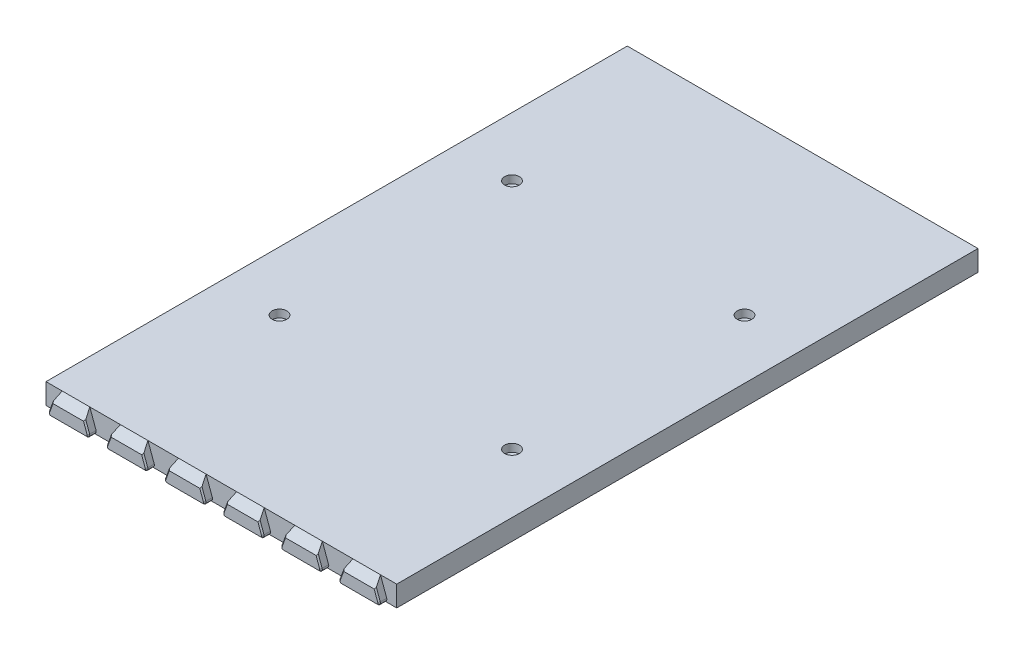
from build123d import *

# Parameters (mm, degrees)
BOSS_EXTRUDE1_DEPTH             = 112.5
SKETCH7_W                       = 131.75
SKETCH7_H                       = 6
BOSS_EXTRUDE7_DEPTH             = 1
BOSS_EXTRUDE4_DEPTH             = 3
BOSS_EXTRUDE8_REACH             = 133.633
BOSS_EXTRUDE8_DIRECTION_2_DEPTH = 2
CHAMFER4_SIZE                   = 0.5
FILLET4_R                       = 1
CHAMFER6_SIZE                   = 0.5
FILLET2_R                       = 2
CHAMFER4_OF_MIRROR2_SIZE        = 0.5
FILLET4_OF_MIRROR2_R            = 1
CHAMFER6_OF_MIRROR2_SIZE        = 0.5
FILLET2_OF_MIRROR2_R            = 2
BOSS_EXTRUDE9_REACH             = 240.023
SKETCH9_R                       = 5
FILLET3_R                       = 3
SKETCH10_R                      = 1.85
CUT_EXTRUDE2_DEPTH              = 239.023140944
SKETCH11_R                      = 2.85
CUT_EXTRUDE3_DEPTH              = 3
CHAMFER7_SIZE                   = 1
CUT_EXTRUDE4_DEPTH              = 239.023140944
CUT_EXTRUDE4_DEPTH_BACK         = 239.023140944


with BuildPart() as part:
    # Sketch1 → Boss-Extrude1 (new body)
    with BuildSketch(Plane.XY):
        Polygon((-67.875, 0), (-67.875, 8), (67.875, 8), (67.875, 0), (65.875, 0), (65.875, 6), (-65.875, 6), (-65.875, 0), align=None)
    boss_extrude1 = extrude(amount=-BOSS_EXTRUDE1_DEPTH)

    # Sketch7 → Boss-Extrude7 (add)
    with BuildSketch(Plane.XY):
        with Locations((0, 3)):
            Rectangle(SKETCH7_W, SKETCH7_H)
    boss_extrude7 = extrude(amount=-BOSS_EXTRUDE7_DEPTH)

    # Sketch2 → Boss-Extrude4 (add)
    with BuildSketch(Plane.XY):
        Polygon((50.911761874, 8), (48, 0), (64.5, 0), (61.588238126, 8), align=None)
        Polygon((28.411761874, 8), (25.5, 0), (42, 0), (39.088238126, 8), align=None)
        Polygon((5.911761874, 8), (3, 0), (19.5, 0), (16.588238126, 8), align=None)
        Polygon((-16.588238126, 8), (-19.5, 0), (-3, 0), (-5.911761874, 8), align=None)
        Polygon((-39.088238126, 8), (-42, 0), (-25.5, 0), (-28.411761874, 8), align=None)
        Polygon((-61.588238126, 8), (-64.5, 0), (-48, 0), (-50.911761874, 8), align=None)
    boss_extrude4 = extrude(amount=BOSS_EXTRUDE4_DEPTH)

    # Sketch8 → Boss-Extrude8 (add, up to next)
    with BuildSketch(Plane.XZ, mode=Mode.PRIVATE) as boss_extrude8_sk1:
        Polygon((-66.35, -20.258341264), (-62.65, -21.605031131), (-62.65, -23.394968869), (-66.35, -24.741658736), align=None)
    boss_extrude8_tool1 = extrude(boss_extrude8_sk1.sketch, amount=-BOSS_EXTRUDE8_REACH, mode=Mode.PRIVATE) - part.part
    # Sketch8 → Boss-Extrude8 (add, up to next)
    with BuildSketch(Plane.XZ, mode=Mode.PRIVATE) as boss_extrude8_sk2:
        Polygon((-66.35, -110.258341264), (-62.65, -111.605031131), (-62.65, -112.35), (-62.65, -112.5), (-66.35, -112.5), (-66.35, -112.35), align=None)
    boss_extrude8_tool2 = extrude(boss_extrude8_sk2.sketch, amount=-BOSS_EXTRUDE8_REACH, mode=Mode.PRIVATE) - part.part
    # Sketch8 → Boss-Extrude8 (add, up to next)
    with BuildSketch(Plane.XZ, mode=Mode.PRIVATE) as boss_extrude8_sk3:
        Polygon((66.35, -24.741658736), (66.35, -20.258341264), (62.65, -21.605031131), (62.65, -23.394968869), align=None)
    boss_extrude8_tool3 = extrude(boss_extrude8_sk3.sketch, amount=-BOSS_EXTRUDE8_REACH, mode=Mode.PRIVATE) - part.part
    # Sketch8 → Boss-Extrude8 (add, up to next)
    with BuildSketch(Plane.XZ, mode=Mode.PRIVATE) as boss_extrude8_sk4:
        Polygon((66.35, -112.5), (62.65, -112.5), (62.65, -112.35), (62.65, -111.605031131), (66.35, -110.258341264), (66.35, -112.35), align=None)
    boss_extrude8_tool4 = extrude(boss_extrude8_sk4.sketch, amount=-BOSS_EXTRUDE8_REACH, mode=Mode.PRIVATE) - part.part
    boss_extrude8_1 = boss_extrude8_tool1.solids().sort_by_distance((-64.764762, 0, -22.5))[0]
    add(boss_extrude8_1)
    boss_extrude8_2 = boss_extrude8_tool2.solids().sort_by_distance((-64.764762, 0, -111.66766))[0]
    add(boss_extrude8_2)
    boss_extrude8_3 = boss_extrude8_tool3.solids().sort_by_distance((64.764762, 0, -22.5))[0]
    add(boss_extrude8_3)
    boss_extrude8_4 = boss_extrude8_tool4.solids().sort_by_distance((64.764762, 0, -111.66766))[0]
    add(boss_extrude8_4)
    boss_extrude8 = boss_extrude8_1 + boss_extrude8_2 + boss_extrude8_3 + boss_extrude8_4  # Boss-Extrude8 as one shape, for the pattern or mirror that repeats it

    # Sketch8 → Boss-Extrude8 direction 2 (add)
    with BuildSketch(Plane.XZ):
        Polygon((-66.35, -20.258341264), (-62.65, -21.605031131), (-62.65, -23.394968869), (-66.35, -24.741658736), align=None)
        Polygon((-66.35, -110.258341264), (-62.65, -111.605031131), (-62.65, -112.35), (-62.65, -112.5), (-66.35, -112.5), (-66.35, -112.35), align=None)
        Polygon((66.35, -24.741658736), (66.35, -20.258341264), (62.65, -21.605031131), (62.65, -23.394968869), align=None)
        Polygon((66.35, -112.5), (62.65, -112.5), (62.65, -112.35), (62.65, -111.605031131), (66.35, -110.258341264), (66.35, -112.35), align=None)
    boss_extrude8_direction_2 = extrude(amount=BOSS_EXTRUDE8_DIRECTION_2_DEPTH)

    # Chamfer4
    chamfer4_edges = [part.edges().sort_by_distance(p)[0] for p in [
        (-66.35, -2, -22.5),
        (-64.5, -2, -24.068313803),
        (-62.65, -2, -22.5),
        (-64.5, -2, -20.931686197),
        (-66.35, -2, -111.379170632),
        (-62.65, -2, -112.052515565),
        (-64.5, -2, -110.931686197),
        (66.35, -2, -111.379170632),
        (64.5, -2, -110.931686197),
        (62.65, -2, -112.052515565),
        (64.5, -2, -24.068313803),
        (66.35, -2, -22.5),
        (64.5, -2, -20.931686197),
        (62.65, -2, -22.5),
    ]]
    chamfer(chamfer4_edges, length=CHAMFER4_SIZE)

    # Fillet4
    fillet4_edges = [part.edges().sort_by_distance(p)[0] for p in [
        (-64.5, 0, 1.5),
        (-48, 0, 1.5),
        (48, 0, 1.5),
        (64.5, 0, 1.5),
        (25.5, 0, 1.5),
        (42, 0, 1.5),
        (3, 0, 1.5),
        (19.5, 0, 1.5),
        (-42, 0, 1.5),
        (-25.5, 0, 1.5),
        (-19.5, 0, 1.5),
        (-3, 0, 1.5),
    ]]
    fillet(fillet4_edges, radius=FILLET4_R)

    # Chamfer6
    chamfer6_edges = [part.edges().sort_by_distance(p)[0] for p in [
        (-62.79989137, 4.671010072, 3),
        (62.79989137, 4.671010072, 3),
        (56.25, 0, 3),
        (33.75, 0, 3),
        (11.25, 0, 3),
        (-11.25, 0, 3),
        (-33.75, 0, 3),
        (-56.25, 0, 3),
        (48.608995962, 0.426423564, 3),
        (63.891004038, 0.426423564, 3),
        (40.29989137, 4.671010072, 3),
        (26.108995962, 0.426423564, 3),
        (41.391004038, 0.426423564, 3),
        (17.79989137, 4.671010072, 3),
        (3.608995962, 0.426423564, 3),
        (18.891004038, 0.426423564, 3),
        (-4.70010863, 4.671010072, 3),
        (-18.891004038, 0.426423564, 3),
        (-3.608995962, 0.426423564, 3),
        (-27.20010863, 4.671010072, 3),
        (-41.391004038, 0.426423564, 3),
        (-26.108995962, 0.426423564, 3),
        (-49.70010863, 4.671010072, 3),
        (-63.891004038, 0.426423564, 3),
        (-48.608995962, 0.426423564, 3),
        (49.70010863, 4.671010072, 3),
        (27.20010863, 4.671010072, 3),
        (4.70010863, 4.671010072, 3),
        (-40.29989137, 4.671010072, 3),
        (-17.79989137, 4.671010072, 3),
    ]]
    chamfer(chamfer6_edges, length=CHAMFER6_SIZE)

    # Fillet2
    fillet2_edges = [part.edges().sort_by_distance(p)[0] for p in [
        (-65.875, 6, -10.715613563),
        (-65.875, 3, -24.568772875),
        (-65.875, 3, -20.431227125),
        (-64.2625, 6, -23.981870872),
        (-64.2625, 6, -21.018129128),
        (-62.65, 6, -22.5),
        (-65.875, 6, -67.5),
        (-65.875, 3, -110.431227125),
        (-62.65, 6, -112.052515565),
        (-64.2625, 6, -111.018129128),
        (65.875, 6, -67.5),
        (65.875, 3, -110.431227125),
        (64.2625, 6, -111.018129128),
        (62.65, 6, -112.052515565),
        (65.875, 6, -10.715613563),
        (65.875, 3, -24.568772875),
        (65.875, 3, -20.431227125),
        (64.2625, 6, -23.981870872),
        (62.65, 6, -22.5),
        (64.2625, 6, -21.018129128),
        (-65.875, 3, -1),
        (0, 6, -1),
        (65.875, 3, -1),
    ]]
    fillet(fillet2_edges, radius=FILLET2_R)


with BuildPart() as mirror2_1:
    # Mirror2: Boss-Extrude1, Boss-Extrude7, Boss-Extrude4, Boss-Extrude8, Boss-Extrude8 direction 2 across plane
    add(boss_extrude1.mirror(Plane.XY.offset(-112.5)))
    add(boss_extrude7.mirror(Plane.XY.offset(-112.5)))
    add(boss_extrude4.mirror(Plane.XY.offset(-112.5)))
    add(boss_extrude8.mirror(Plane.XY.offset(-112.5)))
    add(boss_extrude8_direction_2.mirror(Plane.XY.offset(-112.5)))

    # Chamfer4 of Mirror2
    chamfer4_of_mirror2_edges = [mirror2_1.edges().sort_by_distance(p)[0] for p in [
        (-66.35, -2, -202.5),
        (-64.5, -2, -200.931686197),
        (-62.65, -2, -202.5),
        (-64.5, -2, -204.068313803),
        (-66.35, -2, -113.620829368),
        (-62.65, -2, -112.947484435),
        (-64.5, -2, -114.068313803),
        (66.35, -2, -113.620829368),
        (64.5, -2, -114.068313803),
        (62.65, -2, -112.947484435),
        (64.5, -2, -200.931686197),
        (66.35, -2, -202.5),
        (64.5, -2, -204.068313803),
        (62.65, -2, -202.5),
    ]]
    chamfer(chamfer4_of_mirror2_edges, length=CHAMFER4_OF_MIRROR2_SIZE)

    # Fillet4 of Mirror2
    fillet4_of_mirror2_edges = [mirror2_1.edges().sort_by_distance(p)[0] for p in [
        (-64.5, 0, -226.5),
        (-48, 0, -226.5),
        (48, 0, -226.5),
        (64.5, 0, -226.5),
        (25.5, 0, -226.5),
        (42, 0, -226.5),
        (3, 0, -226.5),
        (19.5, 0, -226.5),
        (-42, 0, -226.5),
        (-25.5, 0, -226.5),
        (-19.5, 0, -226.5),
        (-3, 0, -226.5),
    ]]
    fillet(fillet4_of_mirror2_edges, radius=FILLET4_OF_MIRROR2_R)

    # Chamfer6 of Mirror2
    chamfer6_of_mirror2_edges = [mirror2_1.edges().sort_by_distance(p)[0] for p in [
        (-62.79989137, 4.671010072, -228),
        (62.79989137, 4.671010072, -228),
        (56.25, 0, -228),
        (33.75, 0, -228),
        (11.25, 0, -228),
        (-11.25, 0, -228),
        (-33.75, 0, -228),
        (-56.25, 0, -228),
        (48.608995962, 0.426423564, -228),
        (63.891004038, 0.426423564, -228),
        (40.29989137, 4.671010072, -228),
        (26.108995962, 0.426423564, -228),
        (41.391004038, 0.426423564, -228),
        (17.79989137, 4.671010072, -228),
        (3.608995962, 0.426423564, -228),
        (18.891004038, 0.426423564, -228),
        (-4.70010863, 4.671010072, -228),
        (-18.891004038, 0.426423564, -228),
        (-3.608995962, 0.426423564, -228),
        (-27.20010863, 4.671010072, -228),
        (-41.391004038, 0.426423564, -228),
        (-26.108995962, 0.426423564, -228),
        (-49.70010863, 4.671010072, -228),
        (-63.891004038, 0.426423564, -228),
        (-48.608995962, 0.426423564, -228),
        (49.70010863, 4.671010072, -228),
        (27.20010863, 4.671010072, -228),
        (4.70010863, 4.671010072, -228),
        (-40.29989137, 4.671010072, -228),
        (-17.79989137, 4.671010072, -228),
    ]]
    chamfer(chamfer6_of_mirror2_edges, length=CHAMFER6_OF_MIRROR2_SIZE)

    # Fillet2 of Mirror2
    fillet2_of_mirror2_edges = [mirror2_1.edges().sort_by_distance(p)[0] for p in [
        (-65.875, 6, -214.284386437),
        (-65.875, 3, -200.431227125),
        (-65.875, 3, -204.568772875),
        (-64.2625, 6, -201.018129128),
        (-64.2625, 6, -203.981870872),
        (-62.65, 6, -202.5),
        (-65.875, 6, -157.5),
        (-65.875, 3, -114.568772875),
        (-62.65, 6, -112.947484435),
        (-64.2625, 6, -113.981870872),
        (65.875, 6, -157.5),
        (65.875, 3, -114.568772875),
        (64.2625, 6, -113.981870872),
        (62.65, 6, -112.947484435),
        (65.875, 6, -214.284386437),
        (65.875, 3, -200.431227125),
        (65.875, 3, -204.568772875),
        (64.2625, 6, -201.018129128),
        (62.65, 6, -202.5),
        (64.2625, 6, -203.981870872),
        (-65.875, 3, -224),
        (0, 6, -224),
        (65.875, 3, -224),
    ]]
    fillet(fillet2_of_mirror2_edges, radius=FILLET2_OF_MIRROR2_R)


with BuildPart() as part_1:
    add(part.part)

    # Mirror2 united with what the copies touc: union Mirror2_1
    add(mirror2_1.part)

    # Sketch9 → Boss-Extrude9 (add, up to next)
    with BuildSketch(Plane(origin=(0, 0, 0), x_dir=(1, 0, 0), z_dir=(0, 1, 0)), mode=Mode.PRIVATE) as boss_extrude9_sk1:
        with Locations(Location((-45, 67.5, 0), (0, 0, 90))):
            Circle(SKETCH9_R)
    boss_extrude9_tool1 = extrude(boss_extrude9_sk1.sketch, amount=BOSS_EXTRUDE9_REACH, mode=Mode.PRIVATE) - part_1.part
    # Sketch9 → Boss-Extrude9 (add, up to next)
    with BuildSketch(Plane(origin=(0, 0, 0), x_dir=(1, 0, 0), z_dir=(0, 1, 0)), mode=Mode.PRIVATE) as boss_extrude9_sk2:
        with Locations(Location((45, 67.5, 0), (0, 0, 90))):
            Circle(SKETCH9_R)
    boss_extrude9_tool2 = extrude(boss_extrude9_sk2.sketch, amount=BOSS_EXTRUDE9_REACH, mode=Mode.PRIVATE) - part_1.part
    # Sketch9 → Boss-Extrude9 (add, up to next)
    with BuildSketch(Plane(origin=(0, 0, 0), x_dir=(1, 0, 0), z_dir=(0, 1, 0)), mode=Mode.PRIVATE) as boss_extrude9_sk3:
        with Locations(Location((45, 157.5, 0), (0, 0, 90))):
            Circle(SKETCH9_R)
    boss_extrude9_tool3 = extrude(boss_extrude9_sk3.sketch, amount=BOSS_EXTRUDE9_REACH, mode=Mode.PRIVATE) - part_1.part
    # Sketch9 → Boss-Extrude9 (add, up to next)
    with BuildSketch(Plane(origin=(0, 0, 0), x_dir=(1, 0, 0), z_dir=(0, 1, 0)), mode=Mode.PRIVATE) as boss_extrude9_sk4:
        with Locations(Location((-45, 157.5, 0), (0, 0, 90))):
            Circle(SKETCH9_R)
    boss_extrude9_tool4 = extrude(boss_extrude9_sk4.sketch, amount=BOSS_EXTRUDE9_REACH, mode=Mode.PRIVATE) - part_1.part
    add(boss_extrude9_tool1.solids().sort_by_distance((-45, 0, -67.5))[0])
    add(boss_extrude9_tool2.solids().sort_by_distance((45, 0, -67.5))[0])
    add(boss_extrude9_tool3.solids().sort_by_distance((45, 0, -157.5))[0])
    add(boss_extrude9_tool4.solids().sort_by_distance((-45, 0, -157.5))[0])

    # Fillet3
    fillet3_edges = [part_1.edges().sort_by_distance(p)[0] for p in [
        (-45, 6, -62.5),
        (-45, 6, -152.5),
        (45, 6, -152.5),
        (45, 6, -62.5),
    ]]
    fillet(fillet3_edges, radius=FILLET3_R)

    # Sketch10 → Cut-Extrude2 (cut, through all)
    with BuildSketch(Plane(origin=(0, 0, 0), x_dir=(1, 0, 0), z_dir=(0, 1, 0))):
        with Locations(Location((-45, 157.5, 0), (0, 0, 270))):
            Circle(SKETCH10_R)
        with Locations(Location((-45, 67.5, 0), (0, 0, 270))):
            Circle(SKETCH10_R)
        with Locations(Location((45, 67.5, 0), (0, 0, 270))):
            Circle(SKETCH10_R)
        with Locations(Location((45, 157.5, 0), (0, 0, 270))):
            Circle(SKETCH10_R)
    extrude(amount=CUT_EXTRUDE2_DEPTH, mode=Mode.SUBTRACT)

    # Sketch11 → Cut-Extrude3 (cut)
    with BuildSketch(Plane(origin=(0, 8, 0), x_dir=(1, 0, 0), z_dir=(0, 1, 0))):
        with Locations(Location((-45, 157.5, 0), (0, 0, 270))):
            Circle(SKETCH11_R)
        with Locations(Location((45, 157.5, 0), (0, 0, 270))):
            Circle(SKETCH11_R)
        with Locations(Location((45, 67.5, 0), (0, 0, 270))):
            Circle(SKETCH11_R)
        with Locations(Location((-45, 67.5, 0), (0, 0, 270))):
            Circle(SKETCH11_R)
    extrude(amount=-CUT_EXTRUDE3_DEPTH, mode=Mode.SUBTRACT)

    # Chamfer7
    chamfer7_edges = [part_1.edges().sort_by_distance(p)[0] for p in [
        (-45, 5, -69.35),
        (45, 5, -69.35),
        (45, 5, -159.35),
        (-45, 5, -159.35),
    ]]
    chamfer(chamfer7_edges, length=CHAMFER7_SIZE - 0.0001)  # a hair under: the kernel refuses the full size

    # Sketch12 → Cut-Extrude4 (cut, two sides: drawn at the far end of the back side and taken through both)
    with BuildSketch(Plane(origin=(0, 0, 0), x_dir=(0, 0, -1), z_dir=(1, 0, 0)).offset(-CUT_EXTRUDE4_DEPTH_BACK)):
        Polygon((0, 8), (-3, 5), (-3, 8), align=None)
        Polygon((228, 8), (225, 8), (228, 5), align=None)
    extrude(amount=CUT_EXTRUDE4_DEPTH + CUT_EXTRUDE4_DEPTH_BACK, mode=Mode.SUBTRACT)


solid = part_1.part
